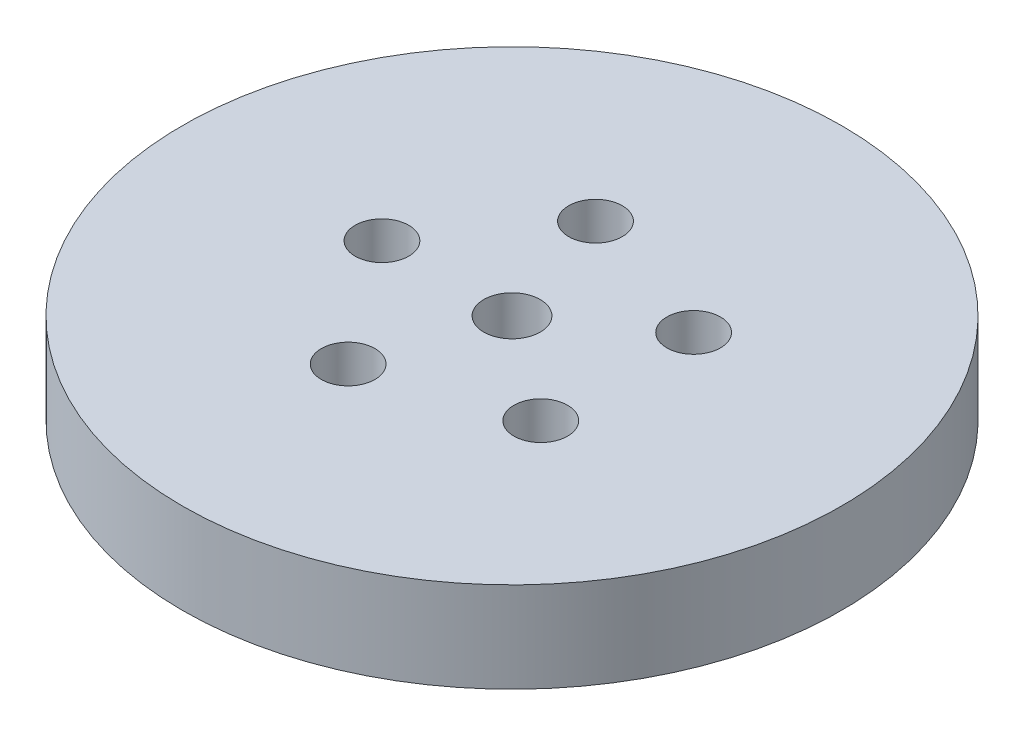
from build123d import *

# Parameters (mm, degrees)
SKETCH1_R           = 87.5
BOSS_EXTRUDE1_DEPTH = 24
SKETCH2_R           = 7.5
CUT_EXTRUDE1_DEPTH  = 127.049593415
SKETCH3_R           = 7.120707896
CUT_EXTRUDE2_DEPTH  = 22.318548442
CIRPATTERN1_COUNT   = 5


with BuildPart() as part:
    # Sketch1 → Boss-Extrude1 (new body)
    with BuildSketch(Plane(origin=(0, 0, 0), x_dir=(1, 0, 0), z_dir=(0, 1, 0))):
        Circle(SKETCH1_R)
    extrude(amount=BOSS_EXTRUDE1_DEPTH)

    # Sketch2 → Cut-Extrude1 (cut, through all)
    with BuildSketch(Plane(origin=(0, 0, 0), x_dir=(1, 0, 0), z_dir=(0, 1, 0))):
        Circle(SKETCH2_R)
    extrude(amount=CUT_EXTRUDE1_DEPTH, mode=Mode.SUBTRACT)

    # Sketch3 → Cut-Extrude2 (cut)
    with BuildSketch(Plane(origin=(0, 24, 0), x_dir=(1, 0, 0), z_dir=(0, 1, 0))):
        with Locations((-34.52893475, 0)):
            Circle(SKETCH3_R)
    cut_extrude2 = extrude(amount=-CUT_EXTRUDE2_DEPTH, mode=Mode.SUBTRACT)

    # CirPattern1: Cut-Extrude2 ×5 about axis
    cirpattern1_axis = Axis((0, 0, 0), (0, 1, 0))
    for i in range(1, CIRPATTERN1_COUNT):
        add(cut_extrude2.rotate(cirpattern1_axis, i * 360 / CIRPATTERN1_COUNT), mode=Mode.SUBTRACT)


solid = part.part
